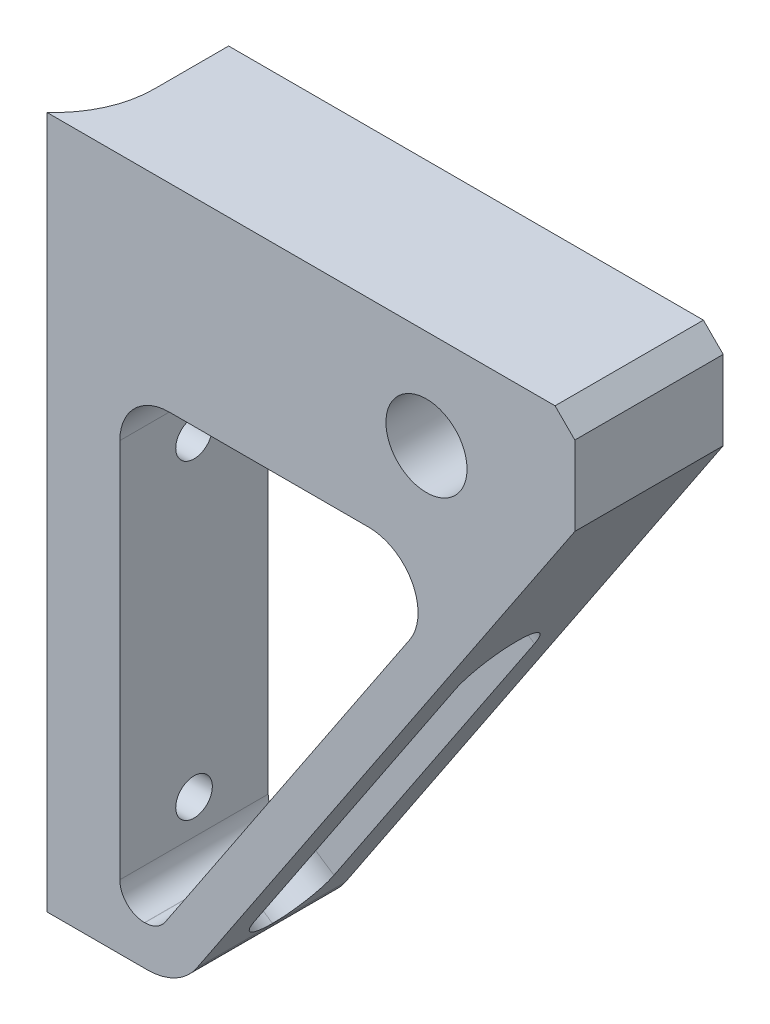
from build123d import *

# Parameters (mm, degrees)
P_IDAT_VYSUNUT_M1_DEPTH  = 15
SKICA3_R                 = 4.1
ODEBRAT_VYSUNUT_M1_DEPTH = 88.321245983
SKICA4_R                 = 4.05
ODEBRAT_VYSUNUT_M2_DEPTH = 10
ODEBRAT_VYSUNUT_M3_DEPTH = 88.321245983
P_IDAT_VYSUNUT_M2_DEPTH  = 70
SKICA7_W                 = 3.385621722
SKICA7_H                 = 7.5
ODEBRAT_VYSUNUT_M5_DEPTH = 10
SKICA9_W                 = 8
SKICA9_H                 = 44.544482181
ODEBRAT_VYSUNUT_M6_DEPTH = 88.290898193
ZAOBLIT2_R               = 4
SKICA10_R                = 1.85
ODEBRAT_VYSUNUT_M7_DEPTH = 86.094065598
ZAOBLIT7_R               = 6
ZKOSEN_1_SIZE            = 2


with BuildPart() as part:
    # Skica1 → Přidat vysunutím1 (new body)
    with BuildSketch(Plane.XY):
        Polygon((0, 0), (0, 70), (50, 70), (50, 60), (10, 0), align=None)
    extrude(amount=P_IDAT_VYSUNUT_M1_DEPTH)

    # Skica3 → Odebrat vysunutím1 (cut, through all)
    with BuildSketch(Plane.XY.offset(15)):
        with Locations((35, 60)):
            Circle(SKICA3_R)
    extrude(amount=-ODEBRAT_VYSUNUT_M1_DEPTH, mode=Mode.SUBTRACT)

    # Skica4 → Odebrat vysunutím2 (cut)
    with BuildSketch(Plane(origin=(0, 0, 0), x_dir=(-1, 0, 0), z_dir=(0, 0, -1))):
        with Locations((-11, 60)):
            Circle(SKICA4_R)
    extrude(amount=-ODEBRAT_VYSUNUT_M2_DEPTH, mode=Mode.SUBTRACT)

    # Skica5 → Odebrat vysunutím3 (cut, through all)
    with BuildSketch(Plane(origin=(0, 0, 0), x_dir=(-1, 0, 0), z_dir=(0, 0, -1))):
        with BuildLine():
            Line((-29.15001284, 49.95), (-9, 49.95))
            ThreePointArc((-9, 49.95), (-5.464466094, 48.485533906), (-4, 44.95))
            Line((-4, 44.95), (-4, 6.5))
            ThreePointArc((-4, 6.5), (-4.732233047, 4.732233047), (-6.5, 4))
            Line((-6.5, 4), (-6.52130557, 4))
            ThreePointArc((-6.52130557, 4), (-7.700950384, 4.295813503), (-8.601431306, 5.113249509))
            Line((-8.601431306, 5.113249509), (-33.310264312, 42.176499019))
            ThreePointArc((-33.310264312, 42.176499019), (-33.558385834, 47.309289628), (-29.15001284, 49.95))
        make_face()
    extrude(amount=-ODEBRAT_VYSUNUT_M3_DEPTH, mode=Mode.SUBTRACT)

    # Skica6 → Přidat vysunutím2 (add)
    with BuildSketch(Plane(origin=(0, 70, 0), x_dir=(1, 0, 0), z_dir=(0, 1, 0))):
        with BuildLine():
            Line((3.452933226, 0), (3.452933226, -15))
            Line((3.452933226, -15), (-3.385621722, -15))
            ThreePointArc((-3.385621722, -15), (0, -7.5), (-3.385621722, 0))
            Line((-3.385621722, 0), (3.452933226, 0))
        make_face()
    extrude(amount=-P_IDAT_VYSUNUT_M2_DEPTH)

    # Skica7 → Odebrat vysunutím5 (cut)
    with BuildSketch(Plane(origin=(0, 70, 0), x_dir=(1, 0, 0), z_dir=(0, 1, 0))):
        with Locations((-1.692810861, -3.75)):
            Rectangle(SKICA7_W, SKICA7_H)
    extrude(amount=-ODEBRAT_VYSUNUT_M5_DEPTH, mode=Mode.SUBTRACT)

    # Skica9 → Odebrat vysunutím6 (cut, through all)
    with BuildSketch(Plane(origin=(3.594875746, -2.39658383, 0), x_dir=(0, 0, 1), z_dir=(-0.8320502943378435, 0.5547001962252294, 0))):
        with Locations((7.5, 31.297937483)):
            Rectangle(SKICA9_W, SKICA9_H)
    extrude(amount=-ODEBRAT_VYSUNUT_M6_DEPTH, mode=Mode.SUBTRACT)

    # Zaoblit2
    zaoblit2_edges = [part.edges().sort_by_distance(p)[0] for p in [
        (10.265531894, 4.003849117, 11.5),
        (10.265531894, 4.003849117, 3.5),
        (34.974364901, 41.067098626, 3.5),
        (34.974364901, 41.067098626, 11.5),
    ]]
    fillet(zaoblit2_edges, radius=ZAOBLIT2_R - 0.0001)  # a hair under: the kernel refuses the full size

    # Skica10 → Odebrat vysunutím7 (cut, through all)
    with BuildSketch(Plane(origin=(4, 0, 0), x_dir=(0, 0, -1), z_dir=(1, 0, 0))):
        with Locations(Location((-7.5, 10, 0), (0, 0, 90))):
            Circle(SKICA10_R)
        with Locations(Location((-7.5, 41.45, 0), (0, 0, 90))):
            Circle(SKICA10_R)
    extrude(amount=-ODEBRAT_VYSUNUT_M7_DEPTH, mode=Mode.SUBTRACT)

    # Zaoblit7
    zaoblit7_edges = [part.edges().sort_by_distance(p)[0] for p in [
        (10, 0, 7.5),
    ]]
    fillet(zaoblit7_edges, radius=ZAOBLIT7_R)

    # Zkosení1
    zkosen_1_edges = [part.edges().sort_by_distance(p)[0] for p in [
        (50, 70, 7.5),
    ]]
    chamfer(zkosen_1_edges, length=ZKOSEN_1_SIZE)


solid = part.part
